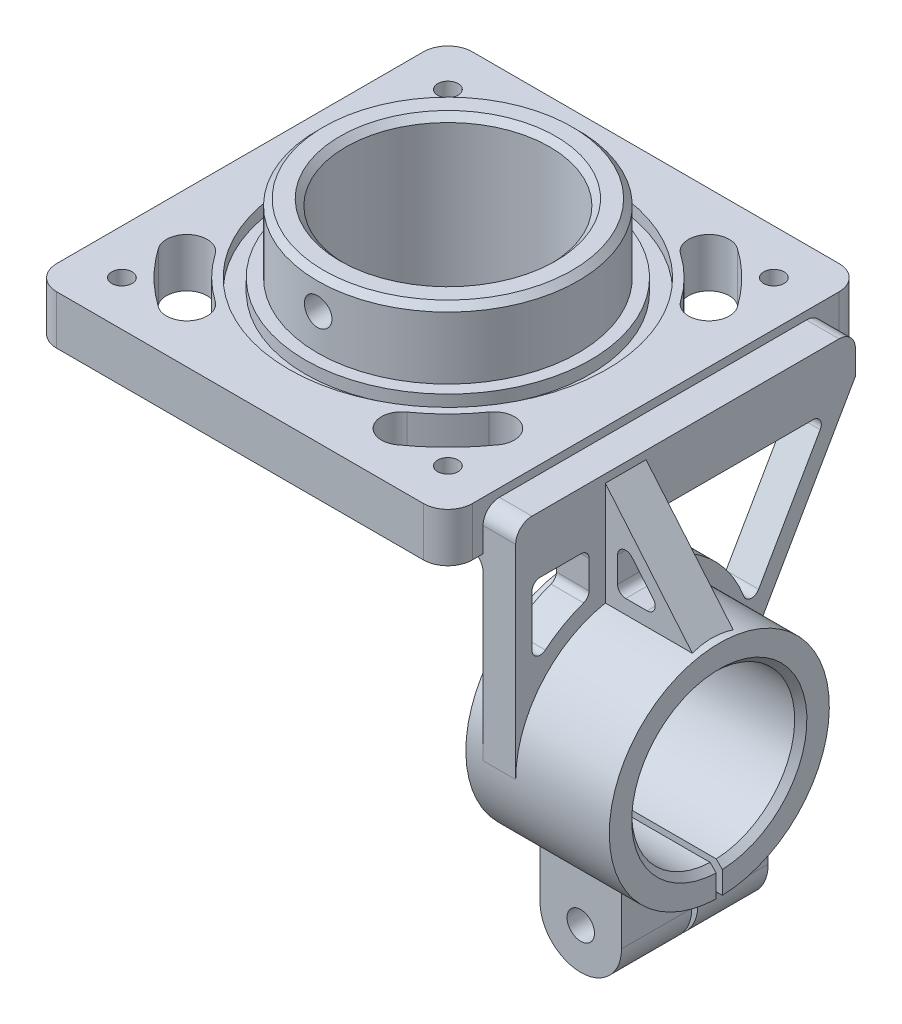
from build123d import *
from build123d.topology import SkipClean

# Parameters (mm, degrees)
ESQUISSE1_W                                        = 161.92499999999998
ESQUISSE1_H                                        = 161.92499999999998
ESQUISSE1_R                                        = 39.6875
BOSS_EXTRU_1_DEPTH                                 = 19.05
TROU_TARAUD_3_8_161_D                              = 7.9375
ESQUISSE4_R                                        = 61.912499999999994
ESQUISSE4_R_2                                      = 55.56250000000001
ENL_V_MAT_EXTRU_1_DEPTH                            = 4.7625
BOSS_EXTRU_2_START                                 = 26.669999999999998
ESQUISSE5_R                                        = 50.8
ESQUISSE5_R_2                                      = 39.6875
BOSS_EXTRU_2_DEPTH                                 = 26.669999999999998
CONG_1_R                                           = 9.525
TROU_TARAUD_1_2_131_REACH                          = 158.932
TROU_TARAUD_1_2_131_BORE_R                         = 5.35813
CHANFREIN2_SIZE                                    = 2.38125
ESQUISSE11_R                                       = 53.975
ESQUISSE11_R_2                                     = 39.6875
BOSS_EXTRU_3_DEPTH                                 = 19.049999999999994
CHANFREIN4_SIZE                                    = 2.38125
ESQUISSE13_R                                       = 31.75
BOSS_EXTRU_4_DEPTH                                 = 12.7
CONG_2_R                                           = 6.35
CONG_3_R                                           = 6.35
BOSS_EXTRU_6_START                                 = 6.7183
ESQUISSE18_R                                       = 42.86249999999998
ESQUISSE18_R_2                                     = 31.749999999999993
BOSS_EXTRU_6_DEPTH                                 = 6.7183
ESQUISSE19_R                                       = 42.8625
ESQUISSE19_R_2                                     = 31.75
BOSS_EXTRU_7_DEPTH                                 = 36.4617
ENL_V_MAT_EXTRU_2_REACH                            = 235.26
NERVURE3_REACH                                     = 215.053
ESQUISSE22_WALL_W                                  = 479.8907625097779
ESQUISSE22_WALL_H                                  = 15.875000000000002
ENL_V_MAT_EXTRU_3_DEPTH                            = 218.0873752383818
BOSS_EXTRU_8_DEPTH                                 = 57.15
ENL_V_START                                        = -57.15
ENL_V_MAT_EXTRU_4_DEPTH                            = 57.15
ENL_V_MAT_EXTRU_5_DEPTH                            = 275.43779249246995
TROU_TARAUD_1_2_132_D                              = 10.71626
TROU_TARAUD_1_2_132_DEPTH                          = 27.384375
CHANFREIN5_SIZE                                    = 2.38125
CHAMBRAGE_POUR_VIS_T_TE_RONDE_BOMB_E_1_D           = 13.49375
CHAMBRAGE_POUR_VIS_T_TE_RONDE_BOMB_E_1_DEPTH       = 27.384375
CHAMBRAGE_POUR_VIS_T_TE_RONDE_BOMB_E_1_CBORE_D     = 20.6375
CHAMBRAGE_POUR_VIS_T_TE_RONDE_BOMB_E_1_CBORE_DEPTH = 12.7
NERVURE6_START                                     = -7.9375
NERVURE6_DEPTH                                     = 15.875
ENL_V_MAT_EXTRU_6_DEPTH                            = 4.7625
ENL_V_START_2                                      = -4.7625
ENL_V_MAT_EXTRU_7_DEPTH                            = 4.7625


# Read off the part's stored shape, not the designer's step: Nervure6
with BuildPart() as part:
    # Esquisse1 → Boss.-Extru.1 (new body)
    with BuildSketch(Plane(origin=(0, 0, 0), x_dir=(1, 0, 0), z_dir=(0, 1, 0))):
        Rectangle(ESQUISSE1_W, ESQUISSE1_H)
        with Locations(Location((1.388e-14, 0, 0), (0, 0, 270))):
            Circle(ESQUISSE1_R, mode=Mode.SUBTRACT)
        with BuildLine():
            ThreePointArc((-46.43818222807173, 66.32059738574735), (-57.249132771815816, 57.249132771815844), (-66.32059738574733, 46.43818222807175))
            ThreePointArc((-66.32059738574733, 46.43818222807175), (-64.37134099773994, 35.38339991299147), (-53.31655868265964, 37.33265630099887))
            ThreePointArc((-53.31655868265964, 37.33265630099887), (-46.0238126204794, 46.02381262047942), (-37.332656300998856, 53.316558682659654))
            ThreePointArc((-37.332656300998856, 53.316558682659654), (-35.38339991299145, 64.37134099773994), (-46.43818222807173, 66.32059738574735))
        make_face(mode=Mode.SUBTRACT)
        with BuildLine():
            ThreePointArc((66.32059738574752, 46.43818222807151), (57.24913277181604, 57.249132771815646), (46.43818222807198, 66.32059738574718))
            ThreePointArc((46.43818222807198, 66.32059738574718), (35.38339991299171, 64.37134099773982), (37.332656300999055, 53.31655868265952))
            ThreePointArc((37.332656300999055, 53.31655868265952), (46.023812620479575, 46.02381262047925), (53.31655868265978, 37.332656300998686))
            ThreePointArc((53.31655868265978, 37.332656300998686), (64.37134099774006, 35.38339991299124), (66.32059738574752, 46.43818222807151))
        make_face(mode=Mode.SUBTRACT)
        with BuildLine():
            ThreePointArc((46.43818222807126, -66.32059738574766), (57.24913277181541, -57.249132771816235), (66.320597385747, -46.438182228072215))
            ThreePointArc((66.320597385747, -46.438182228072215), (64.37134099773968, -35.383399912991926), (53.31655868265938, -37.33265630099925))
            ThreePointArc((53.31655868265938, -37.33265630099925), (46.023812620479085, -46.02381262047974), (37.33265630099848, -53.31655868265992))
            ThreePointArc((37.33265630099848, -53.31655868265992), (35.38339991299101, -64.37134099774019), (46.43818222807126, -66.32059738574766))
        make_face(mode=Mode.SUBTRACT)
        with BuildLine():
            ThreePointArc((-66.32059738574785, -46.43818222807104), (-57.24913277181644, -57.24913277181524), (-46.438182228072456, -66.32059738574685))
            ThreePointArc((-46.438182228072456, -66.32059738574685), (-35.38339991299216, -64.37134099773957), (-37.33265630099944, -53.31655868265925))
            ThreePointArc((-37.33265630099944, -53.31655868265925), (-46.02381262047992, -46.023812620478914), (-53.31655868266005, -37.3326563009983))
            ThreePointArc((-53.31655868266005, -37.3326563009983), (-64.37134099774032, -35.383399912990775), (-66.32059738574785, -46.43818222807104))
        make_face(mode=Mode.SUBTRACT)
    extrude(amount=-BOSS_EXTRU_1_DEPTH)

    # Trou taraudé 3/8-161 (through all)
    with Locations(Plane(origin=(0, 0, 0), x_dir=(1, 0, 0), z_dir=(0, 1, 0))):
        with Locations((-63.5, 63.5), (63.5, 63.5), (-63.5, -63.5), (63.5, -63.5)):
            Hole(TROU_TARAUD_3_8_161_D / 2)

    # Esquisse4 → Enlèv. mat.-Extru.1 (cut)
    with BuildSketch(Plane(origin=(0, 0, 0), x_dir=(1, 0, 0), z_dir=(0, 1, 0))):
        with Locations(Location((0, 0, 0), (0, 0, 270))):
            Circle(ESQUISSE4_R)
        with Locations(Location((0, 0, 0), (0, 0, 270))):
            Circle(ESQUISSE4_R_2, mode=Mode.SUBTRACT)
    extrude(amount=-ENL_V_MAT_EXTRU_1_DEPTH, mode=Mode.SUBTRACT)

    # Esquisse5 → Boss.-Extru.2 (add)
    with BuildSketch(Plane(origin=(0, 0, 0), x_dir=(1, 0, 0), z_dir=(0, 1, 0)).offset(BOSS_EXTRU_2_START)):
        with Locations(Location((0, 0, 0), (0, 0, 270))):
            Circle(ESQUISSE5_R)
        with Locations(Location((0, 0, 0), (0, 0, 270))):
            Circle(ESQUISSE5_R_2, mode=Mode.SUBTRACT)
    extrude(amount=-BOSS_EXTRU_2_DEPTH)

    # Congé1
    cong_1_edges = [part.edges().sort_by_distance(p)[0] for p in [
        (80.96249999999999, -9.525, 80.96249999999998),
        (-80.96249999999999, -9.525, 80.96249999999998),
        (-80.96249999999999, -9.525, -80.9625),
        (80.96249999999999, -9.525, -80.9625),
    ]]
    fillet(cong_1_edges, radius=CONG_1_R)

    # Trou taraudé 1/2-131 bore → Trou taraudé 1/2-131 (cut, up to next)
    with BuildSketch(Plane.XY.offset(50.8), mode=Mode.PRIVATE) as trou_taraud_1_2_131_sk1:
        with Locations((0, 13.97)):
            Circle(TROU_TARAUD_1_2_131_BORE_R)
    trou_taraud_1_2_131_tool1 = extrude(trou_taraud_1_2_131_sk1.sketch, amount=-TROU_TARAUD_1_2_131_REACH, mode=Mode.PRIVATE) & part.part
    add(trou_taraud_1_2_131_tool1.solids().sort_by_distance((0, 13.97, 50.8))[0], mode=Mode.SUBTRACT)

    # Chanfrein2
    chanfrein2_edges = [part.edges().sort_by_distance(p)[0] for p in [
        (1.555e-14, 26.669999999999998, -50.8),
        (1.215e-14, 26.669999999999998, -39.6875),
    ]]
    chamfer(chanfrein2_edges, length=CHANFREIN2_SIZE)

    # Esquisse11 → Boss.-Extru.3 (add)
    with BuildSketch(Plane(origin=(0, -19.05, 0), x_dir=(-1, 0, 0), z_dir=(0, -1, 0))):
        with Locations(Location((0, 0, 0), (0, 0, 90))):
            Circle(ESQUISSE11_R)
        with Locations(Location((0, 0, 0), (0, 0, 270))):
            Circle(ESQUISSE11_R_2, mode=Mode.SUBTRACT)
    extrude(amount=BOSS_EXTRU_3_DEPTH)

    # Chanfrein4
    chanfrein4_edges = [part.edges().sort_by_distance(p)[0] for p in [
        (-1.215e-14, -38.099999999999994, -39.6875),
    ]]
    chamfer(chanfrein4_edges, length=CHANFREIN4_SIZE)

    # Esquisse13 → Boss.-Extru.4 (add)
    with BuildSketch(Plane(origin=(80.96249999999999, 0, 0), x_dir=(0, 0, -1), z_dir=(1, 0, 0))):
        with BuildLine():
            Line((-67.2465, -88.89999999999999), (-67.24649999999998, -3.175))
            Line((-67.24649999999998, -3.175), (65.08750000000002, -3.175))
            Line((65.08750000000002, -3.175), (65.08750000000002, -19.05))
            Line((65.08750000000002, -19.05), (12.797587815125956, -110.2242452104659))
            ThreePointArc((12.797587815125956, -110.2242452104659), (-35.41799516322541, -130.31792917309986), (-67.2465, -88.89999999999999))
        make_face()
        with Locations((-24.384, -88.89999999999999)):
            Circle(ESQUISSE13_R, mode=Mode.SUBTRACT)
    extrude(amount=BOSS_EXTRU_4_DEPTH)

    # Congé2
    cong_2_edges = [part.edges().sort_by_distance(p)[0] for p in [
        (87.31249999999999, -3.175, -65.08750000000002),
        (87.31249999999999, -3.175, 67.24649999999998),
    ]]
    fillet(cong_2_edges, radius=CONG_2_R)

    # Congé3
    # the kernel refuses this fillet: 6.35 mm, written as the material it adds along each edge
    with BuildSketch(Plane(origin=(80.96249999999999, -19.05, 67.24649999999998), x_dir=(-1, 5.6e-16, 0), z_dir=(0, 0, -1))) as cong_3_piece_1_section:
        with BuildLine():
            CenterArc((CONG_3_R, -CONG_3_R), CONG_3_R, 89.99999999999997, 90)
            Line((-3.55e-15, -CONG_3_R), (0, 0))
            Line((0, 0), (CONG_3_R, 0))
        make_face()
    cong_3_piece_1 = extrude(amount=148.20899999999995, mode=Mode.PRIVATE)
    cong_3_piece_1 = split(cong_3_piece_1, bisect_by=Plane(origin=(78.07341806080147, -76.06733711567092, -32.38713002258501), z_dir=(0, 0.4975035336358329, 0.8674619496092378)), keep=Keep.TOP, mode=Mode.PRIVATE)
    add(cong_3_piece_1)

    # Esquisse18 → Boss.-Extru.6 (add)
    with SkipClean():  # the faces are left unmerged after this step: merging them gives an invalid solid
        with BuildSketch(Plane.ZY.offset(-80.96249999999999).offset(BOSS_EXTRU_6_START)):
            with Locations((24.384, -88.89999999999999)):
                Circle(ESQUISSE18_R)
            with Locations(Location((24.384, -88.89999999999999, 0), (0, 0, 180))):
                Circle(ESQUISSE18_R_2, mode=Mode.SUBTRACT)
        extrude(amount=-BOSS_EXTRU_6_DEPTH)

    # Esquisse19 → Boss.-Extru.7 (add)
    with BuildSketch(Plane(origin=(93.6625, 0, 0), x_dir=(0, 0, -1), z_dir=(1, 0, 0))):
        with Locations((-24.384, -88.89999999999999)):
            Circle(ESQUISSE19_R)
        with Locations((-24.384, -88.89999999999999)):
            Circle(ESQUISSE19_R_2, mode=Mode.SUBTRACT)
    extrude(amount=BOSS_EXTRU_7_DEPTH)

    # Esquisse20 → Enlèv. mat.-Extru.2 (cut, up to next)
    with BuildSketch(Plane(origin=(93.6625, 0, 0), x_dir=(0, 0, -1), z_dir=(1, 0, 0)), mode=Mode.PRIVATE) as enl_v_mat_extru_2_sk1:
        with BuildLine():
            Line((-10.09650000000003, -39.50859133411966), (-10.09650000000003, -28.57500000000002))
            ThreePointArc((-10.09650000000003, -28.57500000000002), (-9.166564030267319, -26.32993596973271), (-6.921500000000006, -25.4))
            Line((-6.921500000000006, -25.4), (48.64444890789543, -25.4))
            ThreePointArc((48.64444890789543, -25.4), (51.391790491932454, -26.983541794258752), (51.39864059790478, -30.1545737192938))
            Line((51.39864059790478, -30.1545737192938), (27.393895624447552, -72.00996059940013))
            ThreePointArc((27.393895624447552, -72.00996059940013), (24.385317029127645, -73.59517949612506), (21.668570362654087, -71.54975737222112))
            ThreePointArc((21.668570362654087, -71.54975737222112), (10.05658516256619, -53.74724406380025), (-7.979833333333359, -42.502010041142704))
            ThreePointArc((-7.979833333333359, -42.502010041142704), (-9.513876644445554, -41.34167843879672), (-10.09650000000003, -39.50859133411966))
        make_face()
    enl_v_mat_extru_2_tool1 = extrude(enl_v_mat_extru_2_sk1.sketch, amount=-ENL_V_MAT_EXTRU_2_REACH, mode=Mode.PRIVATE) & part.part
    # Esquisse20 → Enlèv. mat.-Extru.2 (cut, up to next)
    with BuildSketch(Plane(origin=(93.6625, 0, 0), x_dir=(0, 0, -1), z_dir=(1, 0, 0)), mode=Mode.PRIVATE) as enl_v_mat_extru_2_sk2:
        with BuildLine():
            Line((-60.89649999999998, -48.488847455188775), (-60.89649999999998, -28.57500000000002))
            ThreePointArc((-60.89649999999998, -28.57500000000002), (-59.96656403026727, -26.329935969732713), (-57.72149999999996, -25.4))
            Line((-57.72149999999996, -25.4), (-41.84650000000002, -25.4))
            ThreePointArc((-41.84650000000002, -25.4), (-39.601435969732705, -26.32993596973271), (-38.671499999999995, -28.57500000000002))
            Line((-38.671499999999995, -28.57500000000002), (-38.671499999999995, -39.508591334119636))
            ThreePointArc((-38.671499999999995, -39.508591334119636), (-39.25412335555446, -41.3416784387967), (-40.78816666666666, -42.50201004114269))
            ThreePointArc((-40.78816666666666, -42.50201004114269), (-48.61455999928164, -46.06601678140108), (-55.701045454545444, -50.938008215480366))
            ThreePointArc((-55.701045454545444, -50.938008215480366), (-59.075324548858106, -51.36074301229197), (-60.89649999999998, -48.488847455188775))
        make_face()
    enl_v_mat_extru_2_tool2 = extrude(enl_v_mat_extru_2_sk2.sketch, amount=-ENL_V_MAT_EXTRU_2_REACH, mode=Mode.PRIVATE) & part.part
    add(enl_v_mat_extru_2_tool1.solids().sort_by_distance((93.6625, -41.833685, -20.896711))[0], mode=Mode.SUBTRACT)
    add(enl_v_mat_extru_2_tool2.solids().sort_by_distance((93.6625, -36.502861, 50.775659))[0], mode=Mode.SUBTRACT)

    # Esquisse22 wall → Nervure3 (add, up to next)
    with BuildSketch(Plane(origin=(110.30585, -26.202727845, 24.384), x_dir=(0.642787609683, -0.766044443122, 0), z_dir=(0.766044443122, 0.642787609683, 0)), mode=Mode.PRIVATE) as nervure3_sk1:
        Rectangle(ESQUISSE22_WALL_W, ESQUISSE22_WALL_H)
    nervure3_tool1 = extrude(nervure3_sk1.sketch, amount=-NERVURE3_REACH, mode=Mode.PRIVATE) - part.part
    add(nervure3_tool1.solids().sort_by_distance((110.30585, -26.202727845, 24.384))[0])

    # Esquisse23 → Enlèv. mat.-Extru.3 (cut, through all)
    with BuildSketch(Plane.XY.offset(32.3215)):
        with BuildLine():
            Line((98.425, -38.099999999999966), (98.425, -28.176057706315742))
            ThreePointArc((98.425, -28.176057706315742), (100.51408604494098, -25.19253363532039), (104.0321911069028, -26.135207045560943))
            Line((104.0321911069028, -26.135207045560943), (112.35936742535795, -36.059149339245174))
            ThreePointArc((112.35936742535795, -36.059149339245174), (112.80470354229661, -39.44181298102671), (109.92717631845518, -41.27499999999999))
            Line((109.92717631845518, -41.27499999999999), (101.60000000000002, -41.27499999999999))
            ThreePointArc((101.60000000000002, -41.27499999999999), (99.35493596973271, -40.34506403026728), (98.425, -38.099999999999966))
        make_face()
    extrude(amount=-ENL_V_MAT_EXTRU_3_DEPTH, mode=Mode.SUBTRACT)

    # Esquisse25 → Boss.-Extru.8 (add)
    with BuildSketch(Plane.XY.offset(52.958999999999996)):
        with BuildLine():
            Line((120.59919999999998, -107.67338238789476), (88.8492, -107.67338238789478))
            Line((88.8492, -107.67338238789478), (88.84920000000001, -139.7))
            ThreePointArc((88.84920000000001, -139.7), (104.72420000000001, -155.575), (120.5992, -139.7))
            Line((120.5992, -139.7), (120.59919999999998, -107.67338238789476))
        make_face()
    extrude(amount=-BOSS_EXTRU_8_DEPTH)

    # Esquisse26 → Enlèv. mat.-Extru.4 (cut)
    with BuildSketch(Plane(origin=(120.59919999999994, 5.226e-14, 0), x_dir=(0, 0, -1), z_dir=(1, 4.3e-16, 0)).offset(ENL_V_START)):
        with BuildLine():
            Line((-49.98912866044383, -107.6733823878948), (1.2211286604438438, -107.6733823878948))
            ThreePointArc((1.2211286604438438, -107.6733823878948), (-24.383999999999993, -120.65000000000003), (-49.98912866044383, -107.6733823878948))
        make_face()
    extrude(amount=ENL_V_MAT_EXTRU_4_DEPTH, mode=Mode.SUBTRACT)

    # Esquisse27 → Enlèv. mat.-Extru.5 (cut, through all)
    with BuildSketch(Plane(origin=(130.1242, 0, 0), x_dir=(0, 0, -1), z_dir=(1, 0, 0))):
        Polygon((-25.574625, -110.46616872521042), (-23.193375, -110.46616872521042), (-23.193374999999993, -162.34710298990862), (-25.574625, -162.34710298990862), align=None)
    extrude(amount=-ENL_V_MAT_EXTRU_5_DEPTH, mode=Mode.SUBTRACT)

    # Trou taraudé 1/2-132
    with Locations(Plane.XY.offset(52.958999999999996)):
        with Locations((104.7242, -139.7)):
            Hole(TROU_TARAUD_1_2_132_D / 2, depth=TROU_TARAUD_1_2_132_DEPTH)

    # Chanfrein5
    chanfrein5_edges = [part.edges().sort_by_distance(p)[0] for p in [
        (130.1242, -66.03228428821535, 46.40966861924964),
        (74.24419999999999, -58.72529755764691, 34.26073187423099),
    ]]
    chamfer(chanfrein5_edges, length=CHANFREIN5_SIZE)

    # Chambrage pour vis à tête ronde bombée 1/21
    with Locations(Plane(origin=(0, 0, -4.191000000000001), x_dir=(-1, 0, 0), z_dir=(0, 0, -1))):
        with Locations((-104.7242, -139.7)):
            CounterBoreHole(CHAMBRAGE_POUR_VIS_T_TE_RONDE_BOMB_E_1_D / 2, CHAMBRAGE_POUR_VIS_T_TE_RONDE_BOMB_E_1_CBORE_D / 2, CHAMBRAGE_POUR_VIS_T_TE_RONDE_BOMB_E_1_CBORE_DEPTH, depth=CHAMBRAGE_POUR_VIS_T_TE_RONDE_BOMB_E_1_DEPTH)

    # Nervure6 outline → Nervure6 (add)
    with BuildSketch(Plane.XY.offset(24.384).offset(NERVURE6_START)):
        with BuildLine():
            Line((75.8317, -42.8625), (75.8317, -48))
            Line((75.8317, -48), (80.9625, -48))
            Line((80.9625, -48), (80.9625, -25.4))
            ThreePointArc((80.9625, -25.4), (79.102628061, -20.909871939), (74.6125, -19.05))
            Line((74.6125, -19.05), (42, -19.05))
            Line((42, -19.05), (42, -36.5125))
            Line((42, -36.5125), (69.4817, -36.5125))
            ThreePointArc((69.4817, -36.5125), (73.971828061, -38.372371939), (75.8317, -42.8625))
        make_face()
    extrude(amount=NERVURE6_DEPTH)

    # Esquisse37 → Enlèv. mat.-Extru.6 (cut)
    with BuildSketch(Plane.XY.offset(32.3215)):
        with BuildLine():
            Line((50.79999999999998, -23.018749999999997), (71.43749999999999, -23.01875))
            ThreePointArc((71.43749999999999, -23.01875), (76.19999999999999, -27.78125), (71.43749999999999, -32.543749999999996))
            Line((71.43749999999999, -32.543749999999996), (50.79999999999998, -32.54375))
            ThreePointArc((50.79999999999998, -32.54375), (46.03749999999998, -27.781249999999996), (50.79999999999998, -23.018749999999997))
        make_face()
    extrude(amount=-ENL_V_MAT_EXTRU_6_DEPTH, mode=Mode.SUBTRACT)

    # Esquisse38 → Enlèv. mat.-Extru.7 (cut)
    with BuildSketch(Plane(origin=(0, 0, 16.4465), x_dir=(-1, 0, 0), z_dir=(0, 0, -1)).offset(ENL_V_START_2)):
        with BuildLine():
            Line((-71.43749999999999, -23.01875), (-61.91249999999999, -23.01875))
            ThreePointArc((-61.91249999999999, -23.01875), (-57.14999999999999, -27.78125), (-61.91249999999999, -32.543749999999996))
            Line((-61.91249999999999, -32.543749999999996), (-71.43749999999999, -32.543749999999996))
            ThreePointArc((-71.43749999999999, -32.543749999999996), (-76.19999999999999, -27.78125), (-71.43749999999999, -23.01875))
        make_face()
    extrude(amount=ENL_V_MAT_EXTRU_7_DEPTH, mode=Mode.SUBTRACT)


solid = part.part
